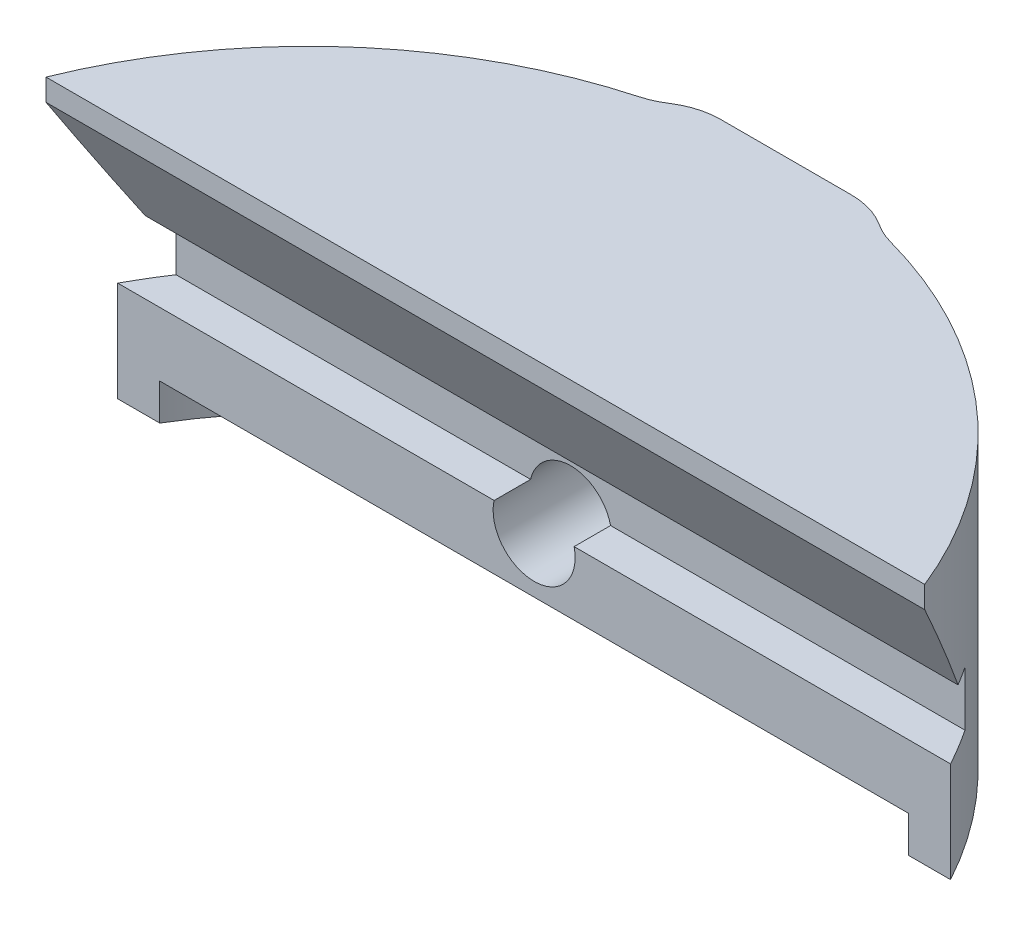
from build123d import *

# Parameters (mm, degrees)
SKETCH_1_R                  = 26
EXTRUDE_1_DEPTH             = 14
CUT_EXTRUDE_1_DEPTH         = 30
HOLE_WIZARD_M32_D           = 3.4
HOLE_WIZARD_M32_CBORE_D     = 6.6
HOLE_WIZARD_M32_CBORE_DEPTH = 3
EXTRUDE_START               = 2
SKETCH_12_R                 = 26
SKETCH_12_R_2               = 24
EXTRUDE_2_DEPTH             = 2
CUT_EXTRUDE_START           = -8
CUT_EXTRUDE_4_DEPTH         = 8
FILLET_2_R                  = 1
SKETCH_18_R                 = 6
CUT_EXTRUDE_5_DEPTH         = 3
CUT_EXTRUDE_START_2         = -10
CUT_EXTRUDE_6_DEPTH         = 10
M4X0_71_D                   = 3.3
M4X0_71_DEPTH               = 11.5
M4X0_71_TIP                 = 0.991420021
SKETCH_20_W                 = 50.531548996
SKETCH_20_H                 = 7
CUT_EXTRUDE_7_DEPTH         = 2
SKETCH_24_W                 = 22.63069338
SKETCH_24_H                 = 1
EXTRUDE_3_DEPTH             = 2
SKETCH_25_W                 = 27.749072331
SKETCH_25_H                 = 11.312162615
CUT_EXTRUDE_8_DEPTH         = 60.799665638
SKETCH_26_W                 = 2
SKETCH_26_H                 = 3
CUT_EXTRUDE_10_DEPTH        = 59.164737265
EXTRUDE_START_2             = -16
EXTRUDE_5_DEPTH             = 16
FILLET_3_R                  = 4
FILLET_4_R                  = 4
HOLE_WIZARD_M41_D           = 4.5


with BuildPart() as part:
    # Эскиз1 → Бобышка-Вытянуть1 (new body)
    with BuildSketch(Plane(origin=(0, 0, 0), x_dir=(1, 0, 0), z_dir=(0, 1, 0))):
        with Locations(Location((0, 0, 0), (0, 0, 270))):
            Circle(SKETCH_1_R)
    extrude(amount=EXTRUDE_1_DEPTH)

    # Эскиз2 → Вырез-Вытянуть1 (cut, symmetric)
    with BuildSketch(Plane(origin=(0, 0, 0), x_dir=(0, 0, -1), z_dir=(1, 0, 0))):
        Polygon((13.654700538, 6), (-13.654700538, 6), (-9.728718708, 12.8), (-9.728718708, 14), (9.728718708, 14), (9.728718708, 12.8), align=None)
    extrude(amount=CUT_EXTRUDE_1_DEPTH, both=True, mode=Mode.SUBTRACT)

    # Цековка для винта с внутренним шестигранником M32 (through all)
    with Locations(Plane(origin=(0, 6, 0), x_dir=(1, 0, 0), z_dir=(0, 1, 0))):
        with Locations((-12.5, 0), (12.5, 0), (-6, 0), (6, 0)):
            CounterBoreHole(HOLE_WIZARD_M32_D / 2, HOLE_WIZARD_M32_CBORE_D / 2, HOLE_WIZARD_M32_CBORE_DEPTH)

    # Эскиз12 → Бобышка-Вытянуть2 (add)
    with BuildSketch(Plane.XZ.offset(EXTRUDE_START)):
        with Locations(Location((0, 0, 0), (0, 0, 270))):
            Circle(SKETCH_12_R)
        with Locations(Location((0, 0, 0), (0, 0, 270))):
            Circle(SKETCH_12_R_2, mode=Mode.SUBTRACT)
    extrude(amount=-EXTRUDE_2_DEPTH)

    # Эскиз17 → Вырез-Вытянуть4 (cut)
    with BuildSketch(Plane(origin=(0, 14, 0), x_dir=(1, 0, 0), z_dir=(0, 1, 0)).offset(CUT_EXTRUDE_START)):
        with BuildLine():
            Line((-24.111242861, -9.728718708), (24.111242861, -9.728718708))
            ThreePointArc((24.111242861, -9.728718708), (0, -26), (-24.111242861, -9.728718708))
        make_face()
    extrude(amount=CUT_EXTRUDE_4_DEPTH, mode=Mode.SUBTRACT)

    # Скругление2
    fillet_2_edges = [part.edges().sort_by_distance(p)[0] for p in [
        (9.25, 4.5, -0.572276157),
        (9.25, 4.5, 0.572276157),
        (-9.25, 4.5, 0.572276157),
        (-9.25, 4.5, -0.572276157),
    ]]
    fillet(fillet_2_edges, radius=FILLET_2_R)

    # Эскиз18 → Вырез-Вытянуть5 (cut)
    with BuildSketch(Plane.XZ):
        Circle(SKETCH_18_R)
    extrude(amount=-CUT_EXTRUDE_5_DEPTH, mode=Mode.SUBTRACT)

    # Эскиз19 → Вырез-Вытянуть6 (cut)
    with BuildSketch(Plane(origin=(0, 6, 0), x_dir=(1, 0, 0), z_dir=(0, 1, 0)).offset(CUT_EXTRUDE_START_2)):
        with BuildLine():
            Line((-22.313739765, -13.345299462), (22.313739765, -13.345299462))
            ThreePointArc((22.313739765, -13.345299462), (0, -26), (-22.313739765, -13.345299462))
        make_face()
    extrude(amount=CUT_EXTRUDE_6_DEPTH, mode=Mode.SUBTRACT)

    # Отверстие обработанное метчиком M4x0.71
    with Locations(Plane.XY.offset(13.345299462)):
        with Locations((0, 3)):
            Hole(M4X0_71_D / 2, depth=M4X0_71_DEPTH)
            with Locations((0, 0, -(M4X0_71_DEPTH + M4X0_71_TIP / 2))):  # 118° drill point
                Cone(0, M4X0_71_D / 2, M4X0_71_TIP, mode=Mode.SUBTRACT)

    # Эскиз20 → Вырез-Вытянуть7 (cut)
    with BuildSketch(Plane.XY.offset(13.345299462)):
        with Locations((0, 1.5)):
            Rectangle(SKETCH_20_W, SKETCH_20_H)
    extrude(amount=-CUT_EXTRUDE_7_DEPTH, mode=Mode.SUBTRACT)

    # Эскиз24 → Бобышка-Вытянуть3 (add)
    with BuildSketch(Plane.XY.offset(11.345299462)):
        with Locations((0, 0.5)):
            Rectangle(SKETCH_24_W, SKETCH_24_H)
    extrude(amount=EXTRUDE_3_DEPTH)

    # Эскиз25 → Вырез-Вытянуть8 (cut, through all)
    with BuildSketch(Plane(origin=(26, 0, 0), x_dir=(0, 0, -1), z_dir=(1, 0, 0))):
        with Locations((-1.469835628, 0.343918692)):
            Rectangle(SKETCH_25_W, SKETCH_25_H)
    extrude(amount=-CUT_EXTRUDE_8_DEPTH, mode=Mode.SUBTRACT)

    # Эскиз26 → Вырез-Вытянуть10 (cut, through all)
    with BuildSketch(Plane(origin=(26, 0, 0), x_dir=(0, 0, -1), z_dir=(1, 0, 0))):
        with Locations((13.404700538, 5)):
            Rectangle(SKETCH_26_W, SKETCH_26_H)
    extrude(amount=-CUT_EXTRUDE_10_DEPTH, mode=Mode.SUBTRACT)

    # Эскиз27 → Бобышка-Вытянуть5 (add)
    with BuildSketch(Plane(origin=(0, 14, 0), x_dir=(1, 0, 0), z_dir=(0, 1, 0)).offset(EXTRUDE_START_2)):
        with BuildLine():
            Line((-5, 26.228718708), (5, 26.228718708))
            Line((5, 26.228718708), (5, 25.514701644))
            ThreePointArc((5, 25.514701644), (0, 26), (-5, 25.514701644))
            Line((-5, 25.514701644), (-5, 26.228718708))
        make_face()
    extrude(amount=EXTRUDE_5_DEPTH)

    # Скругление3
    # the kernel refuses this fillet: 4 mm, written as the material it adds along each edge
    with BuildSketch(Plane(origin=(5, -2, -25.514701644), x_dir=(0.9734574738252592, 0, 0.22886796773193235), z_dir=(0, 1, 0))) as fillet_3_piece_1:
        with BuildLine():
            CenterArc((2.09399194, 3.997202592), FILLET_3_R, 235.642702264, 32.214353504)
            Line((-0.163415634, 0.695065247), (-0.208563786, 0.6290225))
            ThreePointArc((-0.208563786, 0.6290225), (-0.159584415, 0.329223186), (-0.077876598, -0.018309437))
            Line((-0.077876598, -0.018309437), (0.002991417, -0.079944052))
            ThreePointArc((0.002991417, -0.079944052), (0.972210544, -0.061816847), (1.94142967, -0.079944052))
            Line((1.94142967, -0.079944052), (1.944421087, 0))
        make_face()
    extrude(amount=16)
    with BuildSketch(Plane(origin=(-5, -2, -25.514701644), x_dir=(-0.9734574738252595, 0, 0.2288679677319309), z_dir=(0, 1, 0))) as fillet_3_piece_2:
        with BuildLine():
            CenterArc((2.09399194, -3.997202592), FILLET_3_R, 92.142944232, 32.214353504)
            Line((-0.163415634, -0.695065247), (-0.208563786, -0.6290225))
            ThreePointArc((-0.208563786, -0.6290225), (-0.159584415, -0.329223186), (-0.077876598, 0.018309437))
            Line((-0.077876598, 0.018309437), (0.002991417, 0.079944052))
            ThreePointArc((0.002991417, 0.079944052), (0.972210544, 0.061816847), (1.94142967, 0.079944052))
            Line((1.94142967, 0.079944052), (1.944421087, 0))
        make_face()
    extrude(amount=16)

    # Скругление4
    fillet_4_edges = [part.edges().sort_by_distance(p)[0] for p in [
        (5, 6, -26.228718708),
        (-5, 6, -26.228718708),
    ]]
    fillet(fillet_4_edges, radius=FILLET_4_R)

    # Отверстие с зазором M41 (through all)
    with Locations(Plane(origin=(0, 0, -26.228718708), x_dir=(-1, 0, 0), z_dir=(0, 0, -1))):
        with Locations((0, 3)):
            Hole(HOLE_WIZARD_M41_D / 2)


solid = part.part
